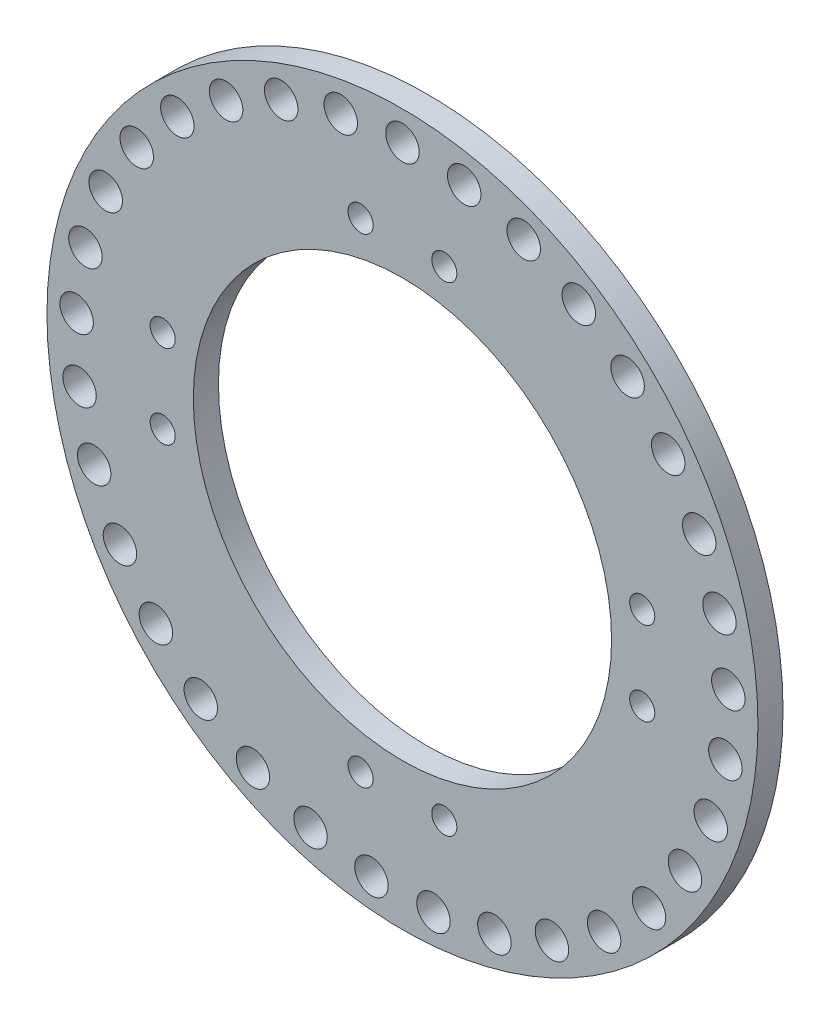
from build123d import *

# Parameters (mm, degrees)
SKETCH1_R           = 42.5
SKETCH1_R_2         = 25
SKETCH1_R_3         = 1.5
BOSS_EXTRUDE1_DEPTH = 3
SKETCH2_R           = 2
CUT_EXTRUDE1_DEPTH  = 61.178899957
CIRPATTERN1_COUNT   = 33


with BuildPart() as part:
    # Sketch1 → Boss-Extrude1 (new body)
    with BuildSketch(Plane.XY):
        Circle(SKETCH1_R)
        Circle(SKETCH1_R_2, mode=Mode.SUBTRACT)
        with Locations((-5, 28.665374196)):
            Circle(SKETCH1_R_3, mode=Mode.SUBTRACT)
        with Locations((5, 28.665374196)):
            Circle(SKETCH1_R_3, mode=Mode.SUBTRACT)
        with Locations((28.665374196, 5)):
            Circle(SKETCH1_R_3, mode=Mode.SUBTRACT)
        with Locations((28.665374196, -5)):
            Circle(SKETCH1_R_3, mode=Mode.SUBTRACT)
        with Locations((5, -28.665374196)):
            Circle(SKETCH1_R_3, mode=Mode.SUBTRACT)
        with Locations((-5, -28.665374196)):
            Circle(SKETCH1_R_3, mode=Mode.SUBTRACT)
        with Locations((-28.665374196, -5)):
            Circle(SKETCH1_R_3, mode=Mode.SUBTRACT)
        with Locations((-28.665374196, 5)):
            Circle(SKETCH1_R_3, mode=Mode.SUBTRACT)
    extrude(amount=BOSS_EXTRUDE1_DEPTH)

    # Sketch2 → Cut-Extrude1 (cut, through all)
    with BuildSketch(Plane.XY.offset(3)):
        with Locations((0, 39)):
            Circle(SKETCH2_R)
    cut_extrude1 = extrude(amount=-CUT_EXTRUDE1_DEPTH, mode=Mode.SUBTRACT)

    # CirPattern1: Cut-Extrude1 ×33 about axis
    cirpattern1_axis = Axis((0, 0, 3), (0, 0, -1))
    for i in range(1, CIRPATTERN1_COUNT):
        add(cut_extrude1.rotate(cirpattern1_axis, i * 360 / CIRPATTERN1_COUNT), mode=Mode.SUBTRACT)


solid = part.part
